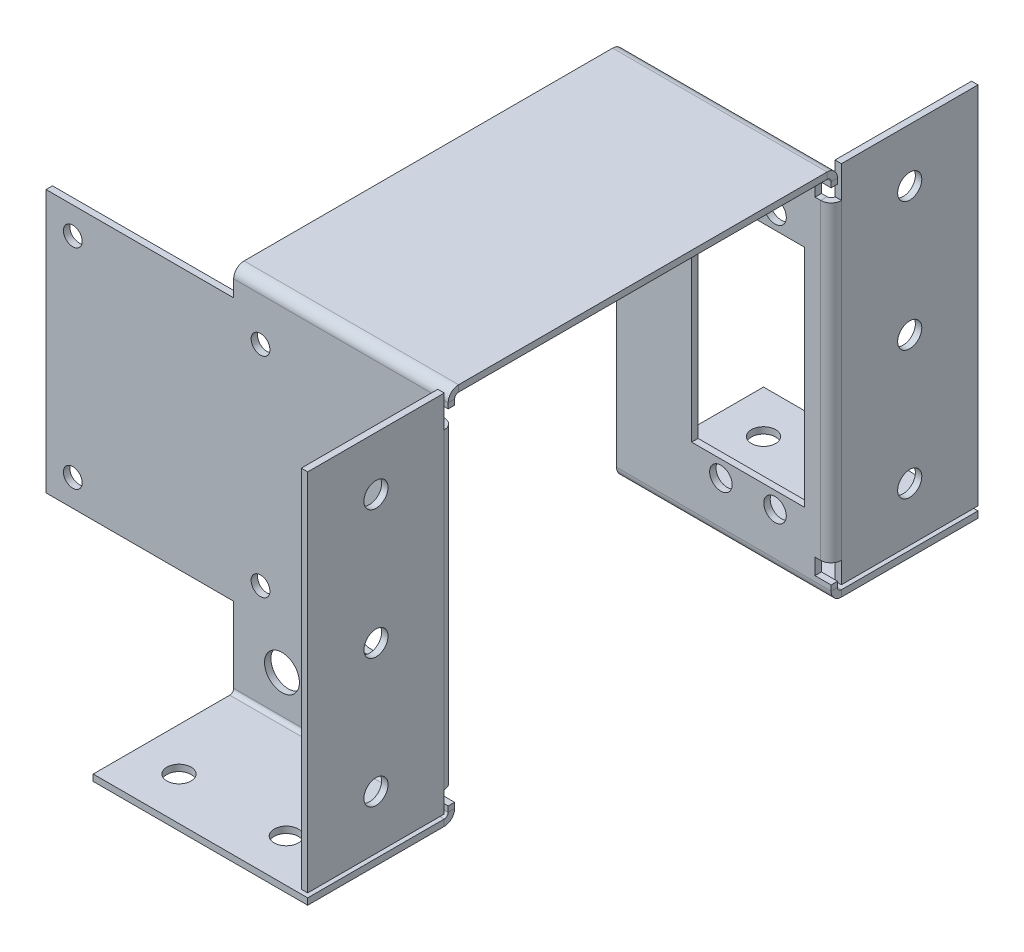
from build123d import *

# Parameters (mm, degrees)
SKETCH_1_W                        = 40
SKETCH_1_H                        = 70
SM_BASE_FLANGE_1_DEPTH            = 1.2
CUT_EXTRUDE_1_REACH               = 82.632
SKETCH_6_R                        = 2.1
SKETCH_6_W                        = 21
SKETCH_6_H                        = 42
SM_EDGE_FLANGE_6_STRIP_W          = 6.2732
SM_EDGE_FLANGE_6_STRIP_H          = 1.2
SM_EDGE_FLANGE_6_STRIP_CUT_DEPTH  = 40
SM_EDGE_FLANGE_6_DEPTH            = 40
SM_EDGE_FLANGE_7_STRIP_W          = 6.2732
SM_EDGE_FLANGE_7_STRIP_H          = 1.2
SM_EDGE_FLANGE_7_STRIP_CUT_DEPTH  = 40
SM_EDGE_FLANGE_7_DEPTH            = 40
SM_EDGE_FLANGE_8_STRIP_W          = 6.2732
SM_EDGE_FLANGE_8_STRIP_H          = 1.2
SM_EDGE_FLANGE_8_STRIP_CUT_DEPTH  = 40
SM_EDGE_FLANGE_8_DEPTH            = 40
SM_EDGE_FLANGE_9_STRIP_W          = 6.2732
SM_EDGE_FLANGE_9_STRIP_H          = 1.2
SM_EDGE_FLANGE_9_STRIP_CUT_DEPTH  = 40
SM_EDGE_FLANGE_9_DEPTH            = 40
SKETCH_50_W                       = 3
SKETCH_50_H                       = 3
CUT_EXTRUDE_7_DEPTH               = 128.520351317
SM_EDGE_FLANGE_13_STRIP_W         = 6.2732
SM_EDGE_FLANGE_13_STRIP_H         = 1.2
SM_EDGE_FLANGE_13_STRIP_CUT_DEPTH = 58.1268
SM_EDGE_FLANGE_13_DEPTH           = 58.1268
SM_EDGE_FLANGE_14_STRIP_W         = 6.2732
SM_EDGE_FLANGE_14_STRIP_H         = 1.2
SM_EDGE_FLANGE_14_STRIP_CUT_DEPTH = 58.1268
SM_EDGE_FLANGE_14_DEPTH           = 58.1268
SKETCH_57_W                       = 25.4634
SKETCH_57_H                       = 5.9366
SKETCH_57_H_2                     = 3.9366
EXTRUDE_1_DEPTH                   = 1.2
CUT_EXTRUDE_9_REACH               = 128.593
SKETCH_58_R                       = 2.25
CUT_EXTRUDE_8_REACH               = 128.593
SKETCH_59_R                       = 2.25
SKETCH_60_W                       = 35
SKETCH_60_H                       = 49
EXTRUDE_2_DEPTH                   = 1.2
CUT_EXTRUDE_10_REACH              = 129.52
SKETCH_61_R                       = 1.75
CUT_EXTRUDE_11_REACH              = 128.593
SKETCH_62_R                       = 4
SKETCH_62_R_2                     = 1.75
CUT_EXTRUDE_12_REACH              = 129.52
SKETCH_63_R                       = 3.25


# Sheet-metal steps are written as plain solids
with BuildPart() as part:
    # Sketch 1 → Базовая кромка1 (new body)
    with BuildSketch(Plane.XY):
        with Locations((20, 35)):
            Rectangle(SKETCH_1_W, SKETCH_1_H)
    extrude(amount=-SM_BASE_FLANGE_1_DEPTH)

    # Эскиз6 → Вырез-Вытянуть1 (cut, up to next)
    with BuildSketch(Plane.XY, mode=Mode.PRIVATE) as cut_extrude_1_sk1:
        with Locations((19.45, 58.1)):
            Circle(SKETCH_6_R)
    cut_extrude_1_tool1 = extrude(cut_extrude_1_sk1.sketch, amount=-CUT_EXTRUDE_1_REACH, mode=Mode.PRIVATE) & part.part
    # Эскиз6 → Вырез-Вытянуть1 (cut, up to next)
    with BuildSketch(Plane.XY, mode=Mode.PRIVATE) as cut_extrude_1_sk2:
        with Locations((29.55, 58.1)):
            Circle(SKETCH_6_R)
    cut_extrude_1_tool2 = extrude(cut_extrude_1_sk2.sketch, amount=-CUT_EXTRUDE_1_REACH, mode=Mode.PRIVATE) & part.part
    # Эскиз6 → Вырез-Вытянуть1 (cut, up to next)
    with BuildSketch(Plane.XY, mode=Mode.PRIVATE) as cut_extrude_1_sk3:
        with Locations((19.45, 9.9)):
            Circle(SKETCH_6_R)
    cut_extrude_1_tool3 = extrude(cut_extrude_1_sk3.sketch, amount=-CUT_EXTRUDE_1_REACH, mode=Mode.PRIVATE) & part.part
    # Эскиз6 → Вырез-Вытянуть1 (cut, up to next)
    with BuildSketch(Plane.XY, mode=Mode.PRIVATE) as cut_extrude_1_sk4:
        with Locations((29.55, 9.9)):
            Circle(SKETCH_6_R)
    cut_extrude_1_tool4 = extrude(cut_extrude_1_sk4.sketch, amount=-CUT_EXTRUDE_1_REACH, mode=Mode.PRIVATE) & part.part
    # Эскиз6 → Вырез-Вытянуть1 (cut, up to next)
    with BuildSketch(Plane.XY, mode=Mode.PRIVATE) as cut_extrude_1_sk5:
        with Locations((24.5, 34)):
            Rectangle(SKETCH_6_W, SKETCH_6_H)
    cut_extrude_1_tool5 = extrude(cut_extrude_1_sk5.sketch, amount=-CUT_EXTRUDE_1_REACH, mode=Mode.PRIVATE) & part.part
    add(cut_extrude_1_tool1.solids().sort_by_distance((19.45, 58.1, 0))[0], mode=Mode.SUBTRACT)
    add(cut_extrude_1_tool2.solids().sort_by_distance((29.55, 58.1, 0))[0], mode=Mode.SUBTRACT)
    add(cut_extrude_1_tool3.solids().sort_by_distance((19.45, 9.9, 0))[0], mode=Mode.SUBTRACT)
    add(cut_extrude_1_tool4.solids().sort_by_distance((29.55, 9.9, 0))[0], mode=Mode.SUBTRACT)
    add(cut_extrude_1_tool5.solids().sort_by_distance((24.5, 34, 0))[0], mode=Mode.SUBTRACT)

    # Ребро-кромка6 strip (across the edge) → Ребро-кромка6 strip cut (cut)
    with BuildSketch(Plane(origin=(40, 0, -1.2), x_dir=(0, 1, 0), z_dir=(-1, 0, 0))):
        with Locations((-1.2, -0.6)):
            Rectangle(SM_EDGE_FLANGE_6_STRIP_W, SM_EDGE_FLANGE_6_STRIP_H)
    extrude(amount=SM_EDGE_FLANGE_6_STRIP_CUT_DEPTH, mode=Mode.SUBTRACT)

    # Ребро-кромка6 section (across the edge) → Ребро-кромка6 (add)
    with BuildSketch(Plane(origin=(40, 0, -1.2), x_dir=(0, 1, 0), z_dir=(-1, 0, 0))):
        with BuildLine():
            Line((0, 0.7366), (0, 26.2))
            Line((0, 26.2), (1.2, 26.2))
            Line((1.2, 26.2), (1.2, 0.7366))
            ThreePointArc((1.2, 0.7366), (1.415745145, 0.215745145), (1.9366, 0))
            Line((1.9366, 0), (1.9366, -1.2))
            ThreePointArc((1.9366, -1.2), (0.567217008, -0.632782992), (0, 0.7366))
        make_face()
    extrude(amount=SM_EDGE_FLANGE_6_DEPTH)

    # Ребро-кромка7 strip (across the edge) → Ребро-кромка7 strip cut (cut)
    with BuildSketch(Plane(origin=(40, 70, 0), x_dir=(0, -1, 0), z_dir=(-1, 0, 0))):
        with Locations((-1.2, -0.6)):
            Rectangle(SM_EDGE_FLANGE_7_STRIP_W, SM_EDGE_FLANGE_7_STRIP_H)
    extrude(amount=SM_EDGE_FLANGE_7_STRIP_CUT_DEPTH, mode=Mode.SUBTRACT)

    # Ребро-кромка7 section (across the edge) → Ребро-кромка7 (add)
    with BuildSketch(Plane(origin=(40, 70, 0), x_dir=(0, -1, 0), z_dir=(-1, 0, 0))):
        with BuildLine():
            Line((0, 0.7366), (0, 71.4))
            Line((0, 71.4), (1.2, 71.4))
            Line((1.2, 71.4), (1.2, 0.7366))
            ThreePointArc((1.2, 0.7366), (1.415745145, 0.215745145), (1.9366, 0))
            Line((1.9366, 0), (1.9366, -1.2))
            ThreePointArc((1.9366, -1.2), (0.567217008, -0.632782992), (0, 0.7366))
        make_face()
    extrude(amount=SM_EDGE_FLANGE_7_DEPTH)

    # Ребро-кромка8 strip (across the edge) → Ребро-кромка8 strip cut (cut)
    with BuildSketch(Plane(origin=(40, 68.8, 71.4), x_dir=(0, 0, -1), z_dir=(-1, 0, 0))):
        with Locations((-1.2, -0.6)):
            Rectangle(SM_EDGE_FLANGE_8_STRIP_W, SM_EDGE_FLANGE_8_STRIP_H)
    extrude(amount=SM_EDGE_FLANGE_8_STRIP_CUT_DEPTH, mode=Mode.SUBTRACT)

    # Ребро-кромка8 section (across the edge) → Ребро-кромка8 (add)
    with BuildSketch(Plane(origin=(40, 68.8, 71.4), x_dir=(0, 0, -1), z_dir=(-1, 0, 0))):
        with BuildLine():
            Line((0, 0.7366), (0, 68.8))
            Line((0, 68.8), (1.2, 68.8))
            Line((1.2, 68.8), (1.2, 0.7366))
            ThreePointArc((1.2, 0.7366), (1.415745145, 0.215745145), (1.9366, 0))
            Line((1.9366, 0), (1.9366, -1.2))
            ThreePointArc((1.9366, -1.2), (0.567217008, -0.632782992), (0, 0.7366))
        make_face()
    extrude(amount=SM_EDGE_FLANGE_8_DEPTH)

    # Ребро-кромка9 strip (across the edge) → Ребро-кромка9 strip cut (cut)
    with BuildSketch(Plane(origin=(0, 0, 71.4), x_dir=(0, 1, 0), z_dir=(1, 0, 0))):
        with Locations((-1.2, -0.6)):
            Rectangle(SM_EDGE_FLANGE_9_STRIP_W, SM_EDGE_FLANGE_9_STRIP_H)
    extrude(amount=SM_EDGE_FLANGE_9_STRIP_CUT_DEPTH, mode=Mode.SUBTRACT)

    # Ребро-кромка9 section (across the edge) → Ребро-кромка9 (add)
    with BuildSketch(Plane(origin=(0, 0, 71.4), x_dir=(0, 1, 0), z_dir=(1, 0, 0))):
        with BuildLine():
            Line((0, 0.7366), (0, 26.2))
            Line((0, 26.2), (1.2, 26.2))
            Line((1.2, 26.2), (1.2, 0.7366))
            ThreePointArc((1.2, 0.7366), (1.415745145, 0.215745145), (1.9366, 0))
            Line((1.9366, 0), (1.9366, -1.2))
            ThreePointArc((1.9366, -1.2), (0.567217008, -0.632782992), (0, 0.7366))
        make_face()
    extrude(amount=SM_EDGE_FLANGE_9_DEPTH)

    # Эскиз50 → Вырез-Вытянуть7 (cut, through all)
    with BuildSketch(Plane.XY.offset(71.4)):
        with Locations((38.5, 65.5634)):
            Rectangle(SKETCH_50_W, SKETCH_50_H)
        with Locations((38.5, 4.4366)):
            Rectangle(SKETCH_50_W, SKETCH_50_H)
    extrude(amount=-CUT_EXTRUDE_7_DEPTH, mode=Mode.SUBTRACT)

    # Ребро-кромка13 strip (across the edge) → Ребро-кромка13 strip cut (cut)
    with BuildSketch(Plane(origin=(40, 5.9366, 71.4), x_dir=(-1, 0, 0), z_dir=(0, 1, 0))):
        with Locations((-1.2, -0.6)):
            Rectangle(SM_EDGE_FLANGE_13_STRIP_W, SM_EDGE_FLANGE_13_STRIP_H)
    extrude(amount=SM_EDGE_FLANGE_13_STRIP_CUT_DEPTH, mode=Mode.SUBTRACT)

    # Ребро-кромка13 section (across the edge) → Ребро-кромка13 (add)
    with BuildSketch(Plane(origin=(40, 5.9366, 71.4), x_dir=(-1, 0, 0), z_dir=(0, 1, 0))):
        with BuildLine():
            Line((0, 0.7366), (0, 26.2))
            Line((0, 26.2), (1.2, 26.2))
            Line((1.2, 26.2), (1.2, 0.7366))
            ThreePointArc((1.2, 0.7366), (1.415745145, 0.215745145), (1.9366, 0))
            Line((1.9366, 0), (1.9366, -1.2))
            ThreePointArc((1.9366, -1.2), (0.567217008, -0.632782992), (0, 0.7366))
        make_face()
    extrude(amount=SM_EDGE_FLANGE_13_DEPTH)

    # Ребро-кромка14 strip (across the edge) → Ребро-кромка14 strip cut (cut)
    with BuildSketch(Plane(origin=(40, 64.0634, -1.2), x_dir=(-1, 0, 0), z_dir=(0, -1, 0))):
        with Locations((-1.2, -0.6)):
            Rectangle(SM_EDGE_FLANGE_14_STRIP_W, SM_EDGE_FLANGE_14_STRIP_H)
    extrude(amount=SM_EDGE_FLANGE_14_STRIP_CUT_DEPTH, mode=Mode.SUBTRACT)

    # Ребро-кромка14 section (across the edge) → Ребро-кромка14 (add)
    with BuildSketch(Plane(origin=(40, 64.0634, -1.2), x_dir=(-1, 0, 0), z_dir=(0, -1, 0))):
        with BuildLine():
            Line((0, 0.7366), (0, 26.2))
            Line((0, 26.2), (1.2, 26.2))
            Line((1.2, 26.2), (1.2, 0.7366))
            ThreePointArc((1.2, 0.7366), (1.415745145, 0.215745145), (1.9366, 0))
            Line((1.9366, 0), (1.9366, -1.2))
            ThreePointArc((1.9366, -1.2), (0.567217008, -0.632782992), (0, 0.7366))
        make_face()
    extrude(amount=SM_EDGE_FLANGE_14_DEPTH)

    # Эскиз57 → Бобышка-Вытянуть1 (add)
    with BuildSketch(Plane(origin=(40, 0, 0), x_dir=(0, 0, -1), z_dir=(1, 0, 0))):
        with Locations((-84.8683, 67.0317)):
            Rectangle(SKETCH_57_W, SKETCH_57_H)
        with Locations((-84.8683, 3.9683)):
            Rectangle(SKETCH_57_W, SKETCH_57_H_2)
        with Locations((14.6683, 67.0317)):
            Rectangle(SKETCH_57_W, SKETCH_57_H)
        with Locations((14.6683, 3.9683)):
            Rectangle(SKETCH_57_W, SKETCH_57_H_2)
    extrude(amount=-EXTRUDE_1_DEPTH)

    # Эскиз58 → Вырез-Вытянуть9 (cut, up to next)
    with BuildSketch(Plane(origin=(40, 0, 0), x_dir=(0, 0, -1), z_dir=(1, 0, 0)), mode=Mode.PRIVATE) as cut_extrude_9_sk1:
        with Locations((-84.8683, 60)):
            Circle(SKETCH_58_R)
    cut_extrude_9_tool1 = extrude(cut_extrude_9_sk1.sketch, amount=-CUT_EXTRUDE_9_REACH, mode=Mode.PRIVATE) & part.part
    # Эскиз58 → Вырез-Вытянуть9 (cut, up to next)
    with BuildSketch(Plane(origin=(40, 0, 0), x_dir=(0, 0, -1), z_dir=(1, 0, 0)), mode=Mode.PRIVATE) as cut_extrude_9_sk2:
        with Locations((-84.8683, 12)):
            Circle(SKETCH_58_R)
    cut_extrude_9_tool2 = extrude(cut_extrude_9_sk2.sketch, amount=-CUT_EXTRUDE_9_REACH, mode=Mode.PRIVATE) & part.part
    # Эскиз58 → Вырез-Вытянуть9 (cut, up to next)
    with BuildSketch(Plane(origin=(40, 0, 0), x_dir=(0, 0, -1), z_dir=(1, 0, 0)), mode=Mode.PRIVATE) as cut_extrude_9_sk3:
        with Locations((14.6683, 60)):
            Circle(SKETCH_58_R)
    cut_extrude_9_tool3 = extrude(cut_extrude_9_sk3.sketch, amount=-CUT_EXTRUDE_9_REACH, mode=Mode.PRIVATE) & part.part
    # Эскиз58 → Вырез-Вытянуть9 (cut, up to next)
    with BuildSketch(Plane(origin=(40, 0, 0), x_dir=(0, 0, -1), z_dir=(1, 0, 0)), mode=Mode.PRIVATE) as cut_extrude_9_sk4:
        with Locations((14.6683, 12)):
            Circle(SKETCH_58_R)
    cut_extrude_9_tool4 = extrude(cut_extrude_9_sk4.sketch, amount=-CUT_EXTRUDE_9_REACH, mode=Mode.PRIVATE) & part.part
    # Эскиз58 → Вырез-Вытянуть9 (cut, up to next)
    with BuildSketch(Plane(origin=(40, 0, 0), x_dir=(0, 0, -1), z_dir=(1, 0, 0)), mode=Mode.PRIVATE) as cut_extrude_9_sk5:
        with Locations((-84.8683, 36)):
            Circle(SKETCH_58_R)
    cut_extrude_9_tool5 = extrude(cut_extrude_9_sk5.sketch, amount=-CUT_EXTRUDE_9_REACH, mode=Mode.PRIVATE) & part.part
    # Эскиз58 → Вырез-Вытянуть9 (cut, up to next)
    with BuildSketch(Plane(origin=(40, 0, 0), x_dir=(0, 0, -1), z_dir=(1, 0, 0)), mode=Mode.PRIVATE) as cut_extrude_9_sk6:
        with Locations((14.6683, 36)):
            Circle(SKETCH_58_R)
    cut_extrude_9_tool6 = extrude(cut_extrude_9_sk6.sketch, amount=-CUT_EXTRUDE_9_REACH, mode=Mode.PRIVATE) & part.part
    add(cut_extrude_9_tool1.solids().sort_by_distance((40, 60, 84.8683))[0], mode=Mode.SUBTRACT)
    add(cut_extrude_9_tool2.solids().sort_by_distance((40, 12, 84.8683))[0], mode=Mode.SUBTRACT)
    add(cut_extrude_9_tool3.solids().sort_by_distance((40, 60, -14.6683))[0], mode=Mode.SUBTRACT)
    add(cut_extrude_9_tool4.solids().sort_by_distance((40, 12, -14.6683))[0], mode=Mode.SUBTRACT)
    add(cut_extrude_9_tool5.solids().sort_by_distance((40, 36, 84.8683))[0], mode=Mode.SUBTRACT)
    add(cut_extrude_9_tool6.solids().sort_by_distance((40, 36, -14.6683))[0], mode=Mode.SUBTRACT)

    # Эскиз59 → Вырез-Вытянуть8 (cut, up to next)
    with BuildSketch(Plane.XZ, mode=Mode.PRIVATE) as cut_extrude_8_sk1:
        with Locations(Location((8, 89.6, 0), (0, 0, 270))):
            Circle(SKETCH_59_R)
    cut_extrude_8_tool1 = extrude(cut_extrude_8_sk1.sketch, amount=-CUT_EXTRUDE_8_REACH, mode=Mode.PRIVATE) & part.part
    # Эскиз59 → Вырез-Вытянуть8 (cut, up to next)
    with BuildSketch(Plane.XZ, mode=Mode.PRIVATE) as cut_extrude_8_sk2:
        with Locations(Location((28, 89.6, 0), (0, 0, 270))):
            Circle(SKETCH_59_R)
    cut_extrude_8_tool2 = extrude(cut_extrude_8_sk2.sketch, amount=-CUT_EXTRUDE_8_REACH, mode=Mode.PRIVATE) & part.part
    # Эскиз59 → Вырез-Вытянуть8 (cut, up to next)
    with BuildSketch(Plane.XZ, mode=Mode.PRIVATE) as cut_extrude_8_sk3:
        with Locations(Location((8, -19.4, 0), (0, 0, 270))):
            Circle(SKETCH_59_R)
    cut_extrude_8_tool3 = extrude(cut_extrude_8_sk3.sketch, amount=-CUT_EXTRUDE_8_REACH, mode=Mode.PRIVATE) & part.part
    # Эскиз59 → Вырез-Вытянуть8 (cut, up to next)
    with BuildSketch(Plane.XZ, mode=Mode.PRIVATE) as cut_extrude_8_sk4:
        with Locations(Location((28, -19.4, 0), (0, 0, 270))):
            Circle(SKETCH_59_R)
    cut_extrude_8_tool4 = extrude(cut_extrude_8_sk4.sketch, amount=-CUT_EXTRUDE_8_REACH, mode=Mode.PRIVATE) & part.part
    add(cut_extrude_8_tool1.solids().sort_by_distance((8, 0, 89.6))[0], mode=Mode.SUBTRACT)
    add(cut_extrude_8_tool2.solids().sort_by_distance((28, 0, 89.6))[0], mode=Mode.SUBTRACT)
    add(cut_extrude_8_tool3.solids().sort_by_distance((8, 0, -19.4))[0], mode=Mode.SUBTRACT)
    add(cut_extrude_8_tool4.solids().sort_by_distance((28, 0, -19.4))[0], mode=Mode.SUBTRACT)

    # Эскиз60 → Бобышка-Вытянуть2 (add)
    with BuildSketch(Plane.XY.offset(71.4)):
        with Locations((-17.5, 40.5)):
            Rectangle(SKETCH_60_W, SKETCH_60_H)
    extrude(amount=-EXTRUDE_2_DEPTH)

    # Эскиз61 → Вырез-Вытянуть10 (cut, up to next)
    with BuildSketch(Plane.XY.offset(71.4), mode=Mode.PRIVATE) as cut_extrude_10_sk1:
        with Locations((-30, 60)):
            Circle(SKETCH_61_R)
    cut_extrude_10_tool1 = extrude(cut_extrude_10_sk1.sketch, amount=-CUT_EXTRUDE_10_REACH, mode=Mode.PRIVATE) & part.part
    # Эскиз61 → Вырез-Вытянуть10 (cut, up to next)
    with BuildSketch(Plane.XY.offset(71.4), mode=Mode.PRIVATE) as cut_extrude_10_sk2:
        with Locations((-30, 21)):
            Circle(SKETCH_61_R)
    cut_extrude_10_tool2 = extrude(cut_extrude_10_sk2.sketch, amount=-CUT_EXTRUDE_10_REACH, mode=Mode.PRIVATE) & part.part
    # Эскиз61 → Вырез-Вытянуть10 (cut, up to next)
    with BuildSketch(Plane.XY.offset(71.4), mode=Mode.PRIVATE) as cut_extrude_10_sk3:
        with Locations((5, 60)):
            Circle(SKETCH_61_R)
    cut_extrude_10_tool3 = extrude(cut_extrude_10_sk3.sketch, amount=-CUT_EXTRUDE_10_REACH, mode=Mode.PRIVATE) & part.part
    # Эскиз61 → Вырез-Вытянуть10 (cut, up to next)
    with BuildSketch(Plane.XY.offset(71.4), mode=Mode.PRIVATE) as cut_extrude_10_sk4:
        with Locations((5, 21)):
            Circle(SKETCH_61_R)
    cut_extrude_10_tool4 = extrude(cut_extrude_10_sk4.sketch, amount=-CUT_EXTRUDE_10_REACH, mode=Mode.PRIVATE) & part.part
    add(cut_extrude_10_tool1.solids().sort_by_distance((-30, 60, 71.4))[0], mode=Mode.SUBTRACT)
    add(cut_extrude_10_tool2.solids().sort_by_distance((-30, 21, 71.4))[0], mode=Mode.SUBTRACT)
    add(cut_extrude_10_tool3.solids().sort_by_distance((5, 60, 71.4))[0], mode=Mode.SUBTRACT)
    add(cut_extrude_10_tool4.solids().sort_by_distance((5, 21, 71.4))[0], mode=Mode.SUBTRACT)

    # Эскиз62 → Вырез-Вытянуть11 (cut, up to next)
    with BuildSketch(Plane(origin=(0, 0, 70.2), x_dir=(-1, 0, 0), z_dir=(0, 0, -1)), mode=Mode.PRIVATE) as cut_extrude_11_sk1:
        with Locations(Location((-24.47, 23.87, 0), (0, 0, 90))):
            Circle(SKETCH_62_R)
    cut_extrude_11_tool1 = extrude(cut_extrude_11_sk1.sketch, amount=-CUT_EXTRUDE_11_REACH, mode=Mode.PRIVATE) & part.part
    # Эскиз62 → Вырез-Вытянуть11 (cut, up to next)
    with BuildSketch(Plane(origin=(0, 0, 70.2), x_dir=(-1, 0, 0), z_dir=(0, 0, -1)), mode=Mode.PRIVATE) as cut_extrude_11_sk2:
        with Locations(Location((-24.47, 32.37, 0), (0, 0, 90))):
            Circle(SKETCH_62_R_2)
    cut_extrude_11_tool2 = extrude(cut_extrude_11_sk2.sketch, amount=-CUT_EXTRUDE_11_REACH, mode=Mode.PRIVATE) & part.part
    # Эскиз62 → Вырез-Вытянуть11 (cut, up to next)
    with BuildSketch(Plane(origin=(0, 0, 70.2), x_dir=(-1, 0, 0), z_dir=(0, 0, -1)), mode=Mode.PRIVATE) as cut_extrude_11_sk3:
        with Locations(Location((-24.47, 15.37, 0), (0, 0, 90))):
            Circle(SKETCH_62_R_2)
    cut_extrude_11_tool3 = extrude(cut_extrude_11_sk3.sketch, amount=-CUT_EXTRUDE_11_REACH, mode=Mode.PRIVATE) & part.part
    add(cut_extrude_11_tool1.solids().sort_by_distance((24.47, 23.87, 70.2))[0], mode=Mode.SUBTRACT)
    add(cut_extrude_11_tool2.solids().sort_by_distance((24.47, 32.37, 70.2))[0], mode=Mode.SUBTRACT)
    add(cut_extrude_11_tool3.solids().sort_by_distance((24.47, 15.37, 70.2))[0], mode=Mode.SUBTRACT)

    # Эскиз63 → Вырез-Вытянуть12 (cut, up to next)
    with BuildSketch(Plane.XY.offset(71.4), mode=Mode.PRIVATE) as cut_extrude_12_sk1:
        with Locations((9, 9)):
            Circle(SKETCH_63_R)
    cut_extrude_12_tool1 = extrude(cut_extrude_12_sk1.sketch, amount=-CUT_EXTRUDE_12_REACH, mode=Mode.PRIVATE) & part.part
    add(cut_extrude_12_tool1.solids().sort_by_distance((9, 9, 71.4))[0], mode=Mode.SUBTRACT)


solid = part.part
